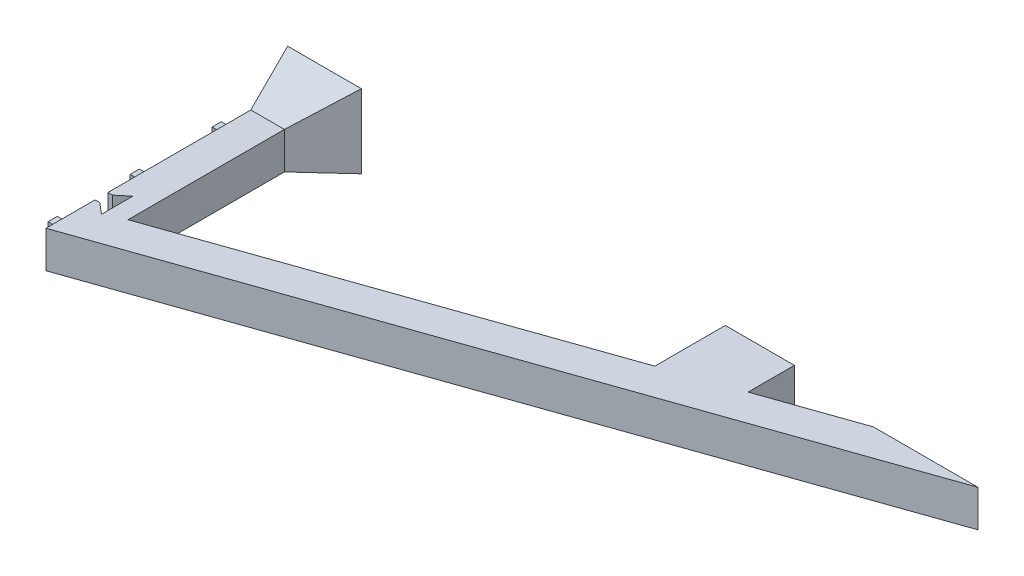
from build123d import *

# Parameters (mm, degrees)
P_IDAT_VYSUNUT_M1_DEPTH  = 8
ODEBRAT_VYSUNUT_M1_DEPTH = 4.4
SKICA3_W                 = 2
SKICA3_H                 = 2
P_IDAT_VYSUNUT_M2_DEPTH  = 4
P_IDAT_START             = 8
SKICA5_W                 = 16
SKICA5_H                 = 8
P_IDAT_VYSUNUT_M4_DEPTH  = 16
ODEBRAT_VYSUNUT_M2_DEPTH = 161.57934176
ODEBRAT_VYSUNUT_M3_DEPTH = 161.57934176


with BuildPart() as part:
    # Skica1 → Přidat vysunutím1 (new body)
    with BuildSketch(Plane(origin=(0, 0, 0), x_dir=(1, 0, 0), z_dir=(0, 1, 0))):
        Polygon((0, 0), (0, -55.45), (149.85, -3), (127.147799643, -3), (107, -10.052066008), (107, 0), (92, 0), (92, -15.302316258), (7.3, -44.948729338), (7.3, 0), align=None)
    extrude(amount=P_IDAT_VYSUNUT_M1_DEPTH)

    # Skica2 → Odebrat vysunutím1 (cut)
    with BuildSketch(Plane(origin=(0, 8, 0), x_dir=(1, 0, 0), z_dir=(0, 1, 0))):
        Polygon((0, -42), (1, -42), (3.4, -40), (3.4, -46.8), (1, -44.8), (0, -44.8), align=None)
    extrude(amount=-ODEBRAT_VYSUNUT_M1_DEPTH, mode=Mode.SUBTRACT)

    # Skica3 → Přidat vysunutím2 (add)
    with BuildSketch(Plane.ZY):
        with Locations((14.4, 4)):
            Rectangle(SKICA3_W, SKICA3_H)
        with Locations((32.2, 4)):
            Rectangle(SKICA3_W, SKICA3_H)
        with Locations((50, 4)):
            Rectangle(SKICA3_W, SKICA3_H)
    extrude(amount=P_IDAT_VYSUNUT_M2_DEPTH)

    # Skica5 → Přidat vysunutím4 (add)
    with BuildSketch(Plane(origin=(0, 8, 0), x_dir=(1, 0, 0), z_dir=(0, 1, 0)).offset(P_IDAT_START)):
        with Locations((8, -7)):
            Rectangle(SKICA5_W, SKICA5_H)
    extrude(amount=-P_IDAT_VYSUNUT_M4_DEPTH)

    # Skica6 → Odebrat vysunutím2 (cut, through all)
    with BuildSketch(Plane.ZY):
        Polygon((3, 16), (11, 16), (11, 8), align=None)
    extrude(amount=-ODEBRAT_VYSUNUT_M2_DEPTH, mode=Mode.SUBTRACT)

    # Skica7 → Odebrat vysunutím3 (cut, through all)
    with BuildSketch(Plane.XZ):
        Polygon((7.3, 11), (16, 11), (16, 3), align=None)
    extrude(amount=-ODEBRAT_VYSUNUT_M3_DEPTH, mode=Mode.SUBTRACT)


solid = part.part
